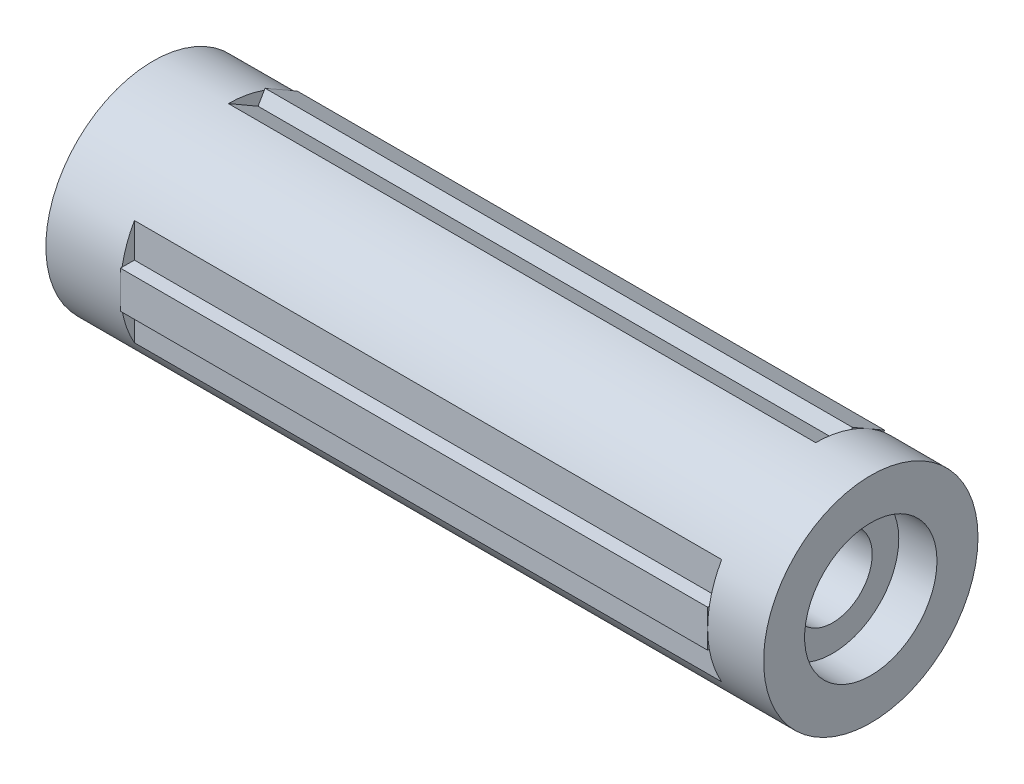
from build123d import *

# Parameters (mm, degrees)
SKIZZE1_R                       = 11.5
AUFSATZ_LINEAR_AUSTRAGEN1_DEPTH = 77
SKIZZE2_R                       = 7.1
SCHNITT_LINEAR_AUSTRAGEN1_DEPTH = 4.1
SKIZZE3_R                       = 4.25
SCHNITT_LINEAR_AUSTRAGEN2_DEPTH = 11
SKIZZE4_R                       = 9.6
SCHNITT_LINEAR_AUSTRAGEN3_DEPTH = 12.75
SCHNITT_LINEAR_START            = -6
SKIZZE7_W                       = 1.5
SKIZZE7_H                       = 15
SCHNITT_LINEAR_AUSTRAGEN4_DEPTH = 63
SKIZZE8_W                       = 63
SKIZZE8_H                       = 4
AUFSATZ_LINEAR_AUSTRAGEN2_DEPTH = 1.5
SCHNITT_LINEAR_AUSTRAGEN6_DEPTH = 13.5
SKIZZE12_R                      = 3
SCHNITT_LINEAR_AUSTRAGEN7_DEPTH = 2
KREISMUSTER3_COUNT              = 3


with BuildPart() as part:
    # Skizze1 → Aufsatz-Linear austragen1 (new body)
    with BuildSketch(Plane(origin=(0, 0, 0), x_dir=(0, 0, -1), z_dir=(1, 0, 0))):
        Circle(SKIZZE1_R)
    extrude(amount=AUFSATZ_LINEAR_AUSTRAGEN1_DEPTH)

    # Skizze2 → Schnitt-Linear austragen1 (cut)
    with BuildSketch(Plane(origin=(77, 0, 0), x_dir=(0, 0, -1), z_dir=(1, 0, 0))):
        Circle(SKIZZE2_R)
    extrude(amount=-SCHNITT_LINEAR_AUSTRAGEN1_DEPTH, mode=Mode.SUBTRACT)

    # Skizze3 → Schnitt-Linear austragen2 (cut)
    with BuildSketch(Plane(origin=(72.9, 0, 0), x_dir=(0, 0, -1), z_dir=(1, 0, 0))):
        Circle(SKIZZE3_R)
    extrude(amount=-SCHNITT_LINEAR_AUSTRAGEN2_DEPTH, mode=Mode.SUBTRACT)

    # Skizze4 → Schnitt-Linear austragen3 (cut)
    with BuildSketch(Plane.ZY):
        Circle(SKIZZE4_R)
    extrude(amount=-SCHNITT_LINEAR_AUSTRAGEN3_DEPTH, mode=Mode.SUBTRACT)

    # Skizze7 → Schnitt-Linear austragen4 (cut)
    with BuildSketch(Plane(origin=(77, 0, 0), x_dir=(0, 0, -1), z_dir=(1, 0, 0)).offset(SCHNITT_LINEAR_START)):
        with Locations((-10.75, 0)):
            Rectangle(SKIZZE7_W, SKIZZE7_H)
    schnitt_linear_austragen4 = extrude(amount=-SCHNITT_LINEAR_AUSTRAGEN4_DEPTH, mode=Mode.SUBTRACT)

    # Skizze8 → Aufsatz-Linear austragen2 (add)
    with BuildSketch(Plane.XY.offset(10)):
        with Locations((39.5, 0)):
            Rectangle(SKIZZE8_W, SKIZZE8_H)
    aufsatz_linear_austragen2 = extrude(amount=AUFSATZ_LINEAR_AUSTRAGEN2_DEPTH)

    # Skizze10 → Schnitt-Linear austragen6 (cut)
    with BuildSketch(Plane.ZY.offset(-12.75)):
        Polygon((4.038863706, -2.240739453), (3.959969143, 2.377388845), (-0.078894563, 4.618128298), (-4.038863706, 2.240739453), (-3.959969143, -2.377388845), (0.078894563, -4.618128298), align=None)
    extrude(amount=-SCHNITT_LINEAR_AUSTRAGEN6_DEPTH, mode=Mode.SUBTRACT)

    # Skizze12 → Schnitt-Linear austragen7 (cut)
    with BuildSketch(Plane.ZY.offset(-26.25)):
        Circle(SKIZZE12_R)
    extrude(amount=-SCHNITT_LINEAR_AUSTRAGEN7_DEPTH, mode=Mode.SUBTRACT)

    # Kreismuster3: Schnitt-Linear austragen4, Aufsatz-Linear austragen2 ×3 about axis
    kreismuster3_axis = Axis((77, 0, 0), (-1, 0, 0))
    add([schnitt_linear_austragen4.rotate(kreismuster3_axis, i * 360 / KREISMUSTER3_COUNT) for i in range(1, KREISMUSTER3_COUNT)], mode=Mode.SUBTRACT)
    add([aufsatz_linear_austragen2.rotate(kreismuster3_axis, i * 360 / KREISMUSTER3_COUNT) for i in range(1, KREISMUSTER3_COUNT)])


solid = part.part
